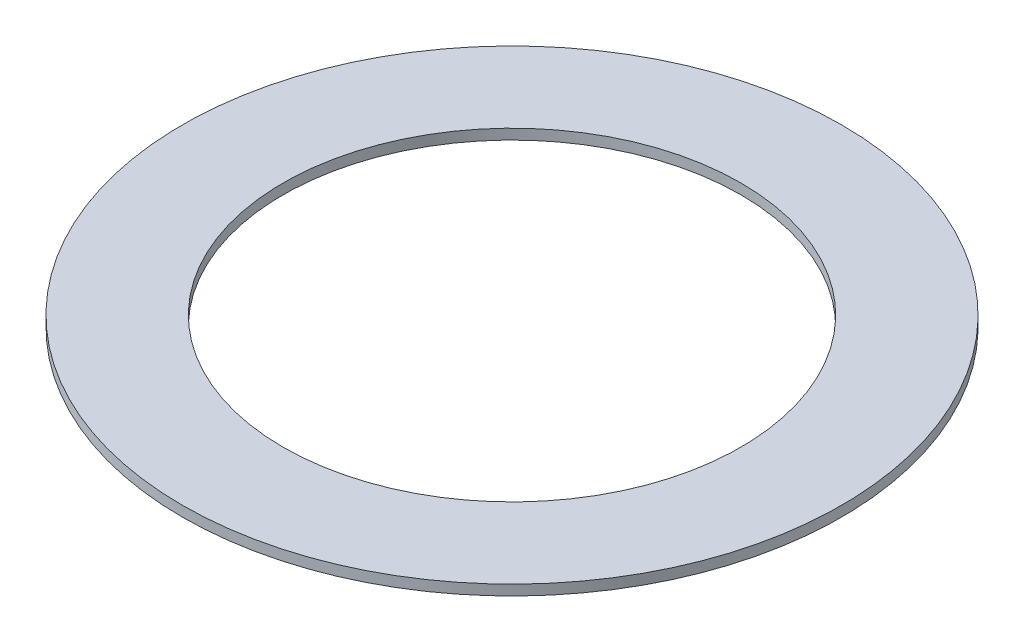
from build123d import *

# Parameters (mm, degrees)
SKETCH1_R           = 8
SKETCH1_R_2         = 5.55625
BOSS_EXTRUDE1_DEPTH = 0.25


with BuildPart() as part:
    # Sketch1 → Boss-Extrude1 (new body)
    with BuildSketch(Plane(origin=(0, 0, 0), x_dir=(1, 0, 0), z_dir=(0, 1, 0))):
        Circle(SKETCH1_R)
        Circle(SKETCH1_R_2, mode=Mode.SUBTRACT)
    extrude(amount=BOSS_EXTRUDE1_DEPTH)


solid = part.part
